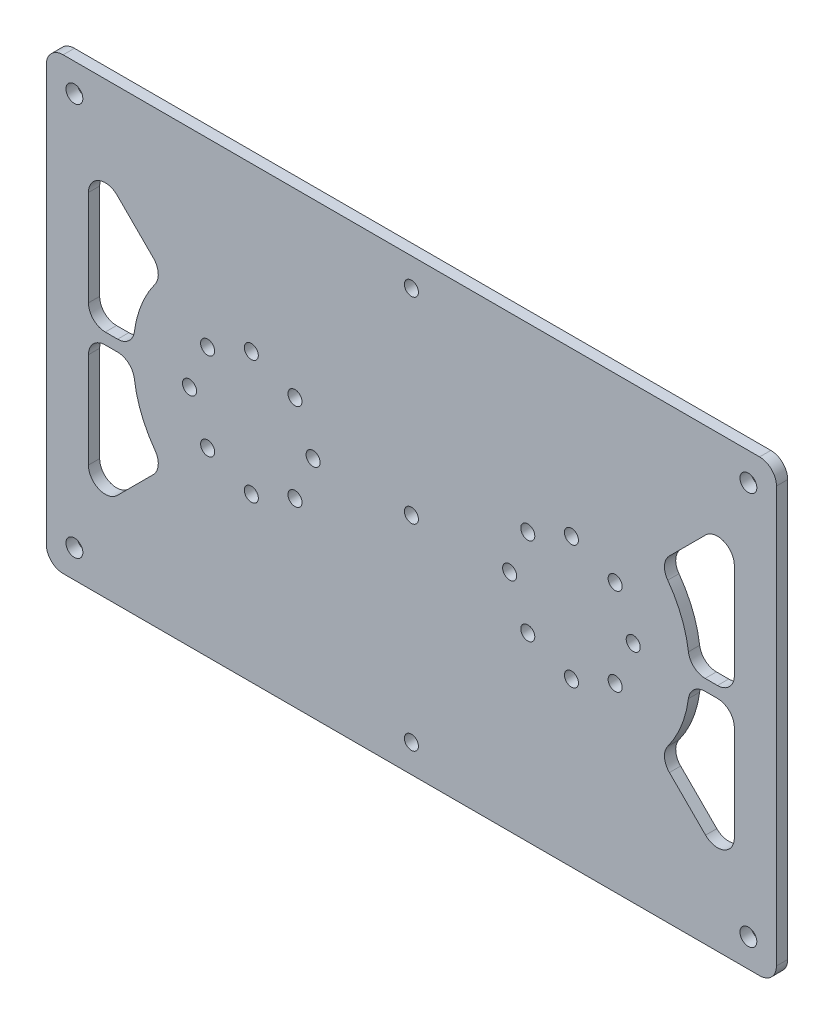
from build123d import *

# Parameters (mm, degrees)
ESBO_O1_W                = 130
ESBO_O1_H                = 80
ESBO_O1_R                = 1.25
ESBO_O1_R_2              = 1.501478649
ESBO_O1_R_3              = 1.5
RESSALTO_EXTRUS_O1_DEPTH = 2
FILETE1_R                = 3
FILETE2_R                = 3


with BuildPart() as part:
    # Esboço1 → Ressalto-extrusão1 (new body)
    with BuildSketch(Plane.XY):
        Rectangle(ESBO_O1_W, ESBO_O1_H)
        with Locations((-39.5, 0)):
            Circle(ESBO_O1_R, mode=Mode.SUBTRACT)
        with Locations((-36.278174593, 7.778174593)):
            Circle(ESBO_O1_R, mode=Mode.SUBTRACT)
        with Locations((-28.5, 11)):
            Circle(ESBO_O1_R, mode=Mode.SUBTRACT)
        with Locations((-20.721825407, 7.778174593)):
            Circle(ESBO_O1_R, mode=Mode.SUBTRACT)
        with Locations((-17.5, 0)):
            Circle(ESBO_O1_R, mode=Mode.SUBTRACT)
        with Locations((-20.721825407, -7.778174593)):
            Circle(ESBO_O1_R, mode=Mode.SUBTRACT)
        with Locations((-28.5, -11)):
            Circle(ESBO_O1_R, mode=Mode.SUBTRACT)
        with Locations((-36.278174593, -7.778174593)):
            Circle(ESBO_O1_R, mode=Mode.SUBTRACT)
        with Locations(Location((39.5, 0, 0), (0, 0, 180))):
            Circle(ESBO_O1_R, mode=Mode.SUBTRACT)
        with Locations(Location((36.278174593, -7.778174593, 0), (0, 0, 180))):
            Circle(ESBO_O1_R, mode=Mode.SUBTRACT)
        with Locations(Location((28.5, -11, 0), (0, 0, 180))):
            Circle(ESBO_O1_R, mode=Mode.SUBTRACT)
        with Locations(Location((20.721825407, -7.778174593, 0), (0, 0, 180))):
            Circle(ESBO_O1_R, mode=Mode.SUBTRACT)
        with Locations(Location((17.5, 0, 0), (0, 0, 180))):
            Circle(ESBO_O1_R, mode=Mode.SUBTRACT)
        with Locations(Location((20.721825407, 7.778174593, 0), (0, 0, 180))):
            Circle(ESBO_O1_R, mode=Mode.SUBTRACT)
        with Locations(Location((28.5, 11, 0), (0, 0, 180))):
            Circle(ESBO_O1_R, mode=Mode.SUBTRACT)
        with Locations(Location((36.278174593, 7.778174593, 0), (0, 0, 180))):
            Circle(ESBO_O1_R, mode=Mode.SUBTRACT)
        with Locations((-60, 35)):
            Circle(ESBO_O1_R_2, mode=Mode.SUBTRACT)
        with Locations((-60, -35)):
            Circle(ESBO_O1_R_2, mode=Mode.SUBTRACT)
        with Locations((60, 35)):
            Circle(ESBO_O1_R_2, mode=Mode.SUBTRACT)
        with Locations((60, -35)):
            Circle(ESBO_O1_R_3, mode=Mode.SUBTRACT)
        Circle(ESBO_O1_R, mode=Mode.SUBTRACT)
        with Locations((0, 35)):
            Circle(ESBO_O1_R, mode=Mode.SUBTRACT)
        with Locations((0, -35)):
            Circle(ESBO_O1_R, mode=Mode.SUBTRACT)
        with BuildLine():
            Line((-57.5, 28.257359313), (-44.008580375, 14.765939688))
            ThreePointArc((-44.008580375, 14.765939688), (-48.076485237, 8.410411341), (-49.5, 1))
            Line((-49.5, 1), (-57.5, 1))
            Line((-57.5, 1), (-57.5, 28.257359313))
        make_face(mode=Mode.SUBTRACT)
        with BuildLine():
            Line((57.5, 28.257359313), (44.008580375, 14.765939688))
            ThreePointArc((44.008580375, 14.765939688), (48.076485237, 8.410411341), (49.5, 1))
            Line((49.5, 1), (57.5, 1))
            Line((57.5, 1), (57.5, 28.257359313))
        make_face(mode=Mode.SUBTRACT)
        with BuildLine():
            Line((57.5, -28.257359313), (44.008580375, -14.765939688))
            ThreePointArc((44.008580375, -14.765939688), (48.076485237, -8.410411341), (49.5, -1))
            Line((49.5, -1), (57.5, -1))
            Line((57.5, -1), (57.5, -28.257359313))
        make_face(mode=Mode.SUBTRACT)
        with BuildLine():
            Line((-57.5, -28.257359313), (-44.008580375, -14.765939688))
            ThreePointArc((-44.008580375, -14.765939688), (-48.076485237, -8.410411341), (-49.5, -1))
            Line((-49.5, -1), (-57.5, -1))
            Line((-57.5, -1), (-57.5, -28.257359313))
        make_face(mode=Mode.SUBTRACT)
    extrude(amount=RESSALTO_EXTRUS_O1_DEPTH)

    # Filete1
    filete1_edges = [part.edges().sort_by_distance(p)[0] for p in [
        (44.008580375, 14.765939688, 1),
        (49.5, 1, 1),
        (57.5, 1, 1),
        (57.5, 28.257359313, 1),
        (49.5, -1, 1),
        (44.008580375, -14.765939688, 1),
        (57.5, -28.257359313, 1),
        (57.5, -1, 1),
        (-44.008580375, -14.765939688, 1),
        (-49.5, -1, 1),
        (-57.5, -1, 1),
        (-57.5, -28.257359313, 1),
        (-49.5, 1, 1),
        (-44.008580375, 14.765939688, 1),
        (-57.5, 28.257359313, 1),
        (-57.5, 1, 1),
    ]]
    fillet(filete1_edges, radius=FILETE1_R)

    # Filete2
    filete2_edges = [part.edges().sort_by_distance(p)[0] for p in [
        (65, -40, 1),
        (-65, -40, 1),
        (-65, 40, 1),
        (65, 40, 1),
    ]]
    fillet(filete2_edges, radius=FILETE2_R)


solid = part.part
